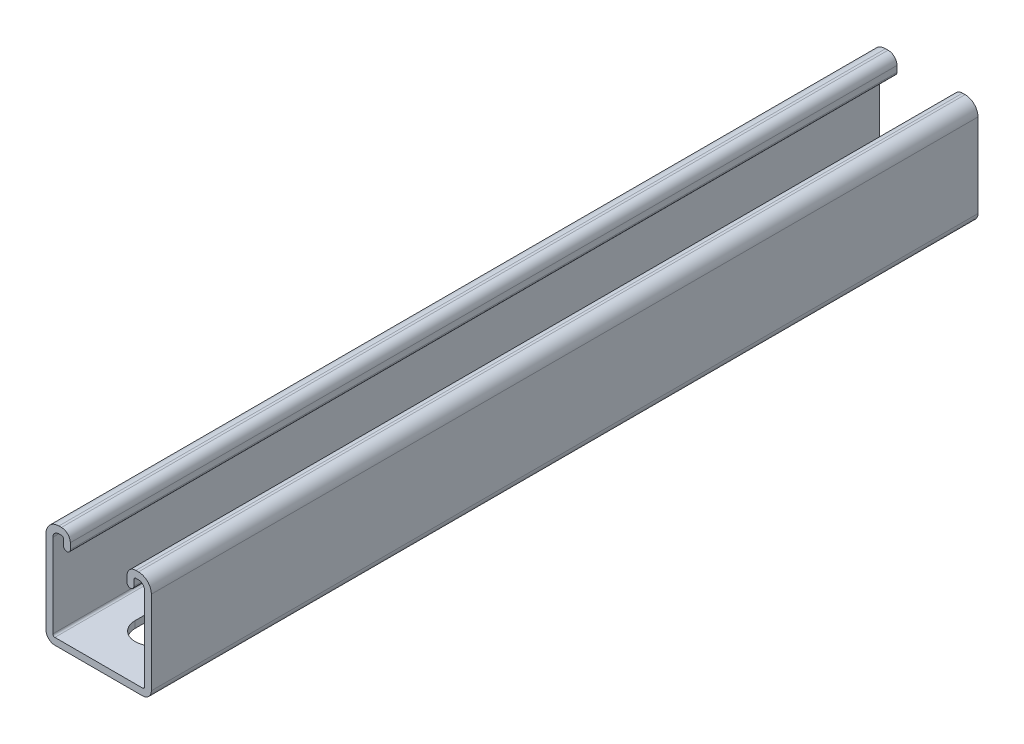
from build123d import *

# Parameters (mm, degrees)
PRIMARY_EXTRUSION_DEPTH = 323.85
SLOT_CUT_REACH          = 329.121
LPATTERN1_COUNT         = 7
LPATTERN1_PITCH         = 50.8


with BuildPart() as part:
    # Sketch1 → Primary Extrusion (new body)
    with BuildSketch(Plane.XY):
        with BuildLine():
            Line((17.176891111, -17.970376528), (-17.176891111, -17.970376528))
            ThreePointArc((-17.176891111, -17.970376528), (-17.738157147, -17.737892523), (-17.970641152, -17.176626487))
            Line((-17.970641152, -17.176626487), (-17.970641152, 15.589126408))
            ThreePointArc((-17.970641152, 15.589126408), (-17.273189139, 17.272924515), (-15.589391032, 17.970376528))
            Line((-15.589391032, 17.970376528), (-14.57342631, 17.970376528))
            ThreePointArc((-14.57342631, 17.970376528), (-14.012171972, 17.737897369), (-13.779692813, 17.176643031))
            Line((-13.779692813, 17.176643031), (-13.779692813, 14.833457753))
            ThreePointArc((-13.779692813, 14.833457753), (-12.446175174, 13.499940114), (-11.112657535, 14.833457753))
            Line((-11.112657535, 14.833457753), (-11.112657535, 17.176643031))
            ThreePointArc((-11.112657535, 17.176643031), (-12.126293241, 19.623776099), (-14.57342631, 20.637411806))
            Line((-14.57342631, 20.637411806), (-15.589391032, 20.637411806))
            ThreePointArc((-15.589391032, 20.637411806), (-19.15906787, 19.158803246), (-20.637676429, 15.589126408))
            Line((-20.637676429, 15.589126408), (-20.637676429, -17.176626487))
            ThreePointArc((-20.637676429, -17.176626487), (-19.624035878, -19.623771254), (-17.176891111, -20.637411806))
            Line((-17.176891111, -20.637411806), (17.176891111, -20.637411806))
            ThreePointArc((17.176891111, -20.637411806), (19.624035878, -19.623771254), (20.637676429, -17.176626487))
            Line((20.637676429, -17.176626487), (20.637676429, 15.589126408))
            ThreePointArc((20.637676429, 15.589126408), (19.15906787, 19.158803246), (15.589391032, 20.637411806))
            Line((15.589391032, 20.637411806), (14.57342631, 20.637411806))
            ThreePointArc((14.57342631, 20.637411806), (12.126293241, 19.623776099), (11.112657535, 17.176643031))
            Line((11.112657535, 17.176643031), (11.112657535, 14.833457753))
            ThreePointArc((11.112657535, 14.833457753), (12.446175174, 13.499940114), (13.779692813, 14.833457753))
            Line((13.779692813, 14.833457753), (13.779692813, 17.176643031))
            ThreePointArc((13.779692813, 17.176643031), (14.012171972, 17.737897369), (14.57342631, 17.970376528))
            Line((14.57342631, 17.970376528), (15.589391032, 17.970376528))
            ThreePointArc((15.589391032, 17.970376528), (17.273189139, 17.272924515), (17.970641152, 15.589126408))
            Line((17.970641152, 15.589126408), (17.970641152, -17.176626487))
            ThreePointArc((17.970641152, -17.176626487), (17.738157147, -17.737892523), (17.176891111, -17.970376528))
        make_face()
    extrude(amount=-PRIMARY_EXTRUSION_DEPTH)

    # Sketch58 → Slot Cut (cut, up to next)
    with BuildSketch(Plane(origin=(0, -20.637411806, 0), x_dir=(-1, 0, 0), z_dir=(0, 1, 0)), mode=Mode.PRIVATE) as slot_cut_sk1:
        with BuildLine():
            Line((7.14375, -29.36875), (7.14375, -21.43125))
            ThreePointArc((7.14375, -21.43125), (0, -14.2875), (-7.14375, -21.43125))
            Line((-7.14375, -21.43125), (-7.14375, -29.36875))
            ThreePointArc((-7.14375, -29.36875), (0, -36.5125), (7.14375, -29.36875))
        make_face()
    slot_cut_tool1 = extrude(slot_cut_sk1.sketch, amount=SLOT_CUT_REACH, mode=Mode.PRIVATE) & part.part
    slot_cut = slot_cut_tool1.solids().sort_by_distance((0, -20.637412, -25.4))[0]
    add(slot_cut, mode=Mode.SUBTRACT)

    # LPattern1: Slot Cut ×7
    with Locations(*[(0, 0, -i * LPATTERN1_PITCH) for i in range(1, LPATTERN1_COUNT)]):
        add(slot_cut, mode=Mode.SUBTRACT)


solid = part.part
